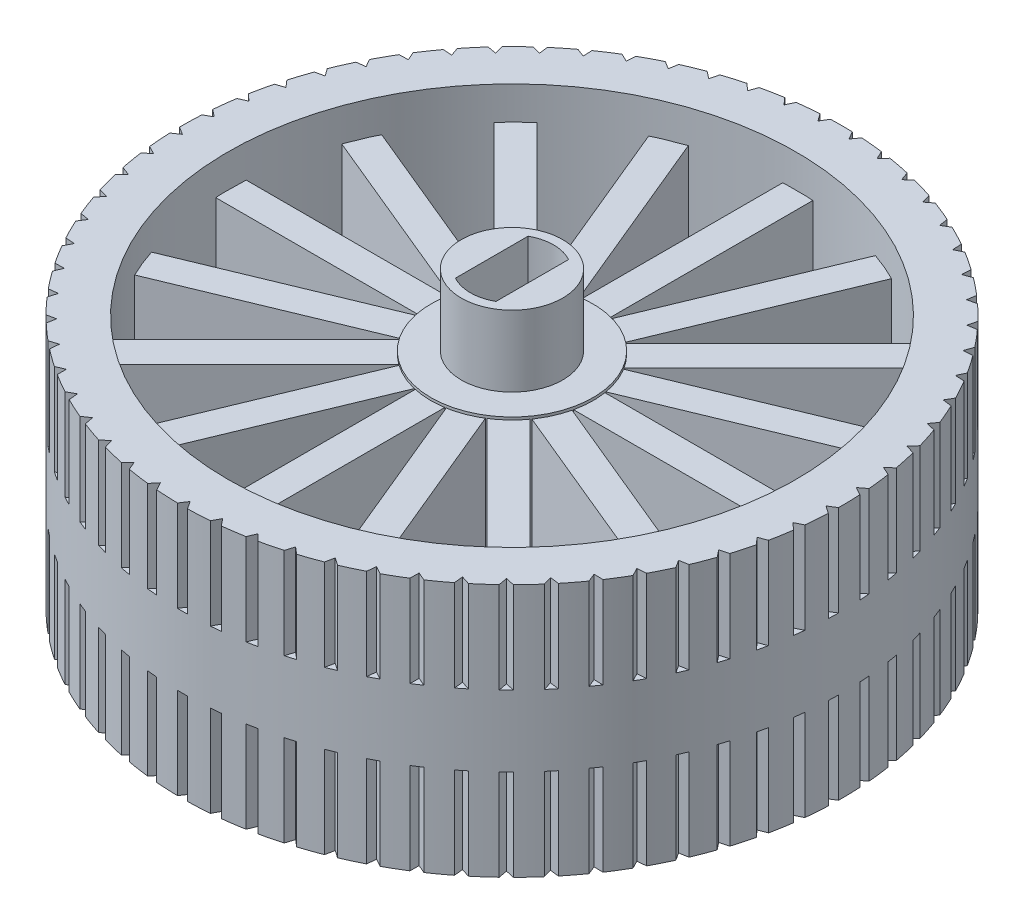
from build123d import *

# Parameters (mm, degrees)
SKETCH1_R               = 32.5
BOSS_EXTRUDE1_DEPTH     = 2
SKETCH2_R               = 4
BOSS_EXTRUDE2_DEPTH     = 2
CUT_EXTRUDE1_DEPTH      = 28
SKETCH5_R               = 8
BOSS_EXTRUDE3_DEPTH     = 2
CUT_EXTRUDE2_DEPTH      = 18
CUT_EXTRUDE2_DEPTH_BACK = 57.005434462
CUT_EXTRUDE2_START      = 10
SKETCH7_R               = 32.5
SKETCH7_R_2             = 28
BOSS_EXTRUDE4_DEPTH     = 23
BOSS_EXTRUDE5_START     = 25
SKETCH9_R               = 8
BOSS_EXTRUDE5_DEPTH     = 25
SKETCH12_W              = 3
SKETCH12_H              = 19.736770602
BOSS_EXTRUDE6_DEPTH     = 22
CIRPATTERN2_COUNT       = 16
CUT_EXTRUDE3_START      = -22
SKETCH13_R              = 28
CUT_EXTRUDE3_DEPTH      = 22
CUT_EXTRUDE6_DEPTH      = 9
SKETCH16_R              = 8
SKETCH16_R_2            = 5
CUT_EXTRUDE7_DEPTH      = 7


with BuildPart() as part:
    # Sketch1 → Boss-Extrude1 (new body)
    with BuildSketch(Plane(origin=(0, 0, 0), x_dir=(1, 0, 0), z_dir=(0, 1, 0))):
        Circle(SKETCH1_R)
    extrude(amount=BOSS_EXTRUDE1_DEPTH)

    # Sketch2 → Boss-Extrude2 (add)
    with BuildSketch(Plane(origin=(0, 2, 0), x_dir=(1, 0, 0), z_dir=(0, 1, 0))):
        Circle(SKETCH2_R)
    extrude(amount=BOSS_EXTRUDE2_DEPTH)

    # Sketch4 → Cut-Extrude1 (cut)
    with BuildSketch(Plane(origin=(0, 4, 0), x_dir=(1, 0, 0), z_dir=(0, 1, 0))):
        with BuildLine():
            Line((1.995, -3.581895448), (1.995, 3.581895448))
            ThreePointArc((1.995, 3.581895448), (0, 4.1), (-1.995, 3.581895448))
            Line((-1.995, 3.581895448), (-1.995, -3.581895448))
            ThreePointArc((-1.995, -3.581895448), (0, -4.1), (1.995, -3.581895448))
        make_face()
    extrude(amount=-CUT_EXTRUDE1_DEPTH, mode=Mode.SUBTRACT)

    # Sketch5 → Boss-Extrude3 (add)
    with BuildSketch(Plane(origin=(0, 2, 0), x_dir=(1, 0, 0), z_dir=(0, 1, 0))):
        Circle(SKETCH5_R)
    extrude(amount=BOSS_EXTRUDE3_DEPTH)

    # Sketch6 → Cut-Extrude2 (cut, two sides: drawn at the far end of the back side and taken through both)
    with BuildSketch(Plane.XZ.offset(-2).offset(CUT_EXTRUDE2_START - CUT_EXTRUDE2_DEPTH_BACK)):
        with BuildLine():
            Line((-1.995, 3.581895448), (-1.995, -3.581895448))
            ThreePointArc((-1.995, -3.581895448), (0, -4.1), (1.995, -3.581895448))
            Line((1.995, -3.581895448), (1.995, 3.581895448))
            ThreePointArc((1.995, 3.581895448), (0, 4.1), (-1.995, 3.581895448))
        make_face()
    extrude(amount=CUT_EXTRUDE2_DEPTH + CUT_EXTRUDE2_DEPTH_BACK, mode=Mode.SUBTRACT)

    # Sketch7 → Boss-Extrude4 (add)
    with BuildSketch(Plane(origin=(0, 2, 0), x_dir=(1, 0, 0), z_dir=(0, 1, 0))):
        Circle(SKETCH7_R)
        Circle(SKETCH7_R_2, mode=Mode.SUBTRACT)
    extrude(amount=BOSS_EXTRUDE4_DEPTH)

    # Sketch9 → Boss-Extrude5 (add)
    with BuildSketch(Plane(origin=(0, 4, 0), x_dir=(1, 0, 0), z_dir=(0, 1, 0)).offset(BOSS_EXTRUDE5_START)):
        Circle(SKETCH9_R)
        with BuildLine():
            Line((-1.995, -3.581895448), (-1.995, 3.581895448))
            ThreePointArc((-1.995, 3.581895448), (0, 4.1), (1.995, 3.581895448))
            Line((1.995, 3.581895448), (1.995, -3.581895448))
            ThreePointArc((1.995, -3.581895448), (0, -4.1), (-1.995, -3.581895448))
        make_face(mode=Mode.SUBTRACT)
    extrude(amount=-BOSS_EXTRUDE5_DEPTH)

    # Sketch13 → Cut-Extrude3 (cut)
    with BuildSketch(Plane(origin=(0, 2, 0), x_dir=(1, 0, 0), z_dir=(0, 1, 0)).offset(CUT_EXTRUDE3_START)):
        Circle(SKETCH13_R)
    extrude(amount=CUT_EXTRUDE3_DEPTH, mode=Mode.SUBTRACT)


with BuildPart() as body_2:
    # Sketch12 → Boss-Extrude6 (new body)
    with BuildSketch(Plane(origin=(-6.995, 0, 0), x_dir=(0, 0, -1), z_dir=(1, 0, 0))):
        with Locations((0.23460174, 11.868385301)):
            Rectangle(SKETCH12_W, SKETCH12_H)
    extrude(amount=-BOSS_EXTRUDE6_DEPTH)


with BuildPart() as cirpattern2_1:
    # CirPattern2: pattern copy
    add(body_2.part.rotate(Axis((0, 4, 0), (0, -1, 0)), 1 * 360 / CIRPATTERN2_COUNT))


with BuildPart() as cirpattern2_2:
    # CirPattern2: pattern copy
    add(body_2.part.rotate(Axis((0, 4, 0), (0, -1, 0)), 2 * 360 / CIRPATTERN2_COUNT))


with BuildPart() as cirpattern2_3:
    # CirPattern2: pattern copy
    add(body_2.part.rotate(Axis((0, 4, 0), (0, -1, 0)), 3 * 360 / CIRPATTERN2_COUNT))


with BuildPart() as cirpattern2_4:
    # CirPattern2: pattern copy
    add(body_2.part.rotate(Axis((0, 4, 0), (0, -1, 0)), 4 * 360 / CIRPATTERN2_COUNT))


with BuildPart() as cirpattern2_5:
    # CirPattern2: pattern copy
    add(body_2.part.rotate(Axis((0, 4, 0), (0, -1, 0)), 5 * 360 / CIRPATTERN2_COUNT))


with BuildPart() as cirpattern2_6:
    # CirPattern2: pattern copy
    add(body_2.part.rotate(Axis((0, 4, 0), (0, -1, 0)), 6 * 360 / CIRPATTERN2_COUNT))


with BuildPart() as cirpattern2_7:
    # CirPattern2: pattern copy
    add(body_2.part.rotate(Axis((0, 4, 0), (0, -1, 0)), 7 * 360 / CIRPATTERN2_COUNT))


with BuildPart() as cirpattern2_8:
    # CirPattern2: pattern copy
    add(body_2.part.rotate(Axis((0, 4, 0), (0, -1, 0)), 8 * 360 / CIRPATTERN2_COUNT))


with BuildPart() as cirpattern2_9:
    # CirPattern2: pattern copy
    add(body_2.part.rotate(Axis((0, 4, 0), (0, -1, 0)), 9 * 360 / CIRPATTERN2_COUNT))


with BuildPart() as cirpattern2_10:
    # CirPattern2: pattern copy
    add(body_2.part.rotate(Axis((0, 4, 0), (0, -1, 0)), 10 * 360 / CIRPATTERN2_COUNT))


with BuildPart() as cirpattern2_11:
    # CirPattern2: pattern copy
    add(body_2.part.rotate(Axis((0, 4, 0), (0, -1, 0)), 11 * 360 / CIRPATTERN2_COUNT))


with BuildPart() as cirpattern2_12:
    # CirPattern2: pattern copy
    add(body_2.part.rotate(Axis((0, 4, 0), (0, -1, 0)), 12 * 360 / CIRPATTERN2_COUNT))


with BuildPart() as cirpattern2_13:
    # CirPattern2: pattern copy
    add(body_2.part.rotate(Axis((0, 4, 0), (0, -1, 0)), 13 * 360 / CIRPATTERN2_COUNT))


with BuildPart() as cirpattern2_14:
    # CirPattern2: pattern copy
    add(body_2.part.rotate(Axis((0, 4, 0), (0, -1, 0)), 14 * 360 / CIRPATTERN2_COUNT))


with BuildPart() as cirpattern2_15:
    # CirPattern2: pattern copy
    add(body_2.part.rotate(Axis((0, 4, 0), (0, -1, 0)), 15 * 360 / CIRPATTERN2_COUNT))


with BuildPart() as cut_extrude3_piece_1:
    # of the separate pieces the step leaves, piece 1, a body of its own (cut_extrude3_pieces)
    add(part.part.solids().sort_by_distance((32.5, 0, 0))[0])

    # Sketch14 → Cut-Extrude6 (cut)
    with BuildSketch(Plane.XZ):
        Polygon((0, 31.75), (-0.527732221, 32.541598332), (0.518724425, 32.537676028), align=None)
        Polygon((3.656641521, 32.335714142), (2.615448673, 32.44061577), (3.064316989, 31.601779402), align=None)
        Polygon((6.76041754, 31.831842406), (5.734209828, 32.036743919), (6.100023276, 31.158501505), align=None)
        Polygon((9.801073362, 31.030765335), (8.799432211, 31.333753622), (9.078775289, 30.424305074), align=None)
        Polygon((12.750219203, 29.939962368), (11.782496667, 30.33820851), (11.972761224, 29.406045104), align=None)
        Polygon((15.580319683, 28.569618039), (14.655551125, 29.059403719), (14.754960712, 28.113228814), align=None)
        Polygon((18.264950915, 26.932526884), (17.391770651, 27.509279105), (17.399397109, 26.557926882), align=None)
        Polygon((20.779047222, 25.043973983), (19.965607901, 25.702307765), (19.881380022, 24.754660742), align=None)
        Polygon((23.099135164, 22.921592244), (22.353031649, 23.655360901), (22.177735847, 22.720267004), align=None)
        Polygon((25.203552704, 20.585197774), (24.531751163, 21.387550307), (24.267024127, 20.473740254), align=None)
        Polygon((27.072651464, 18.056604859), (26.481424327, 18.920049918), (26.129737742, 18.036055709), align=None)
        Polygon((28.688980171, 15.359422289), (28.183847566, 16.275898121), (27.748485036, 15.42997337), align=None)
        Polygon((30.0374476, 12.518832932), (29.623125815, 13.479782648), (29.108152201, 12.679825528), align=None)
        Polygon((31.105463474, 9.561358605), (30.785820919, 10.557810076), (30.196044392, 9.811289571), align=None)
        Polygon((31.883056017, 6.514612449), (31.661077108, 7.537262077), (31.002004253, 6.851148247), align=None)
        Polygon((32.362965055, 3.407041111), (32.240722351, 4.446340692), (31.518506753, 3.827039598), align=None)
        Polygon((32.540709809, 0.267659149), (32.519344656, 1.313905022), (31.740729447, 0.767198911), align=None)
        Polygon((32.414630723, -2.874221875), (32.494342602, -1.830798224), (31.666597503, -2.299804905), align=None)
        Polygon((31.985904964, -5.989267063), (32.165949626, -4.958407802), (31.29680307, -5.345336063), align=None)
        Polygon((31.258535428, -9.048392079), (31.537231845, -8.039722061), (30.634798819, -8.340959258), align=None)
        Polygon((30.239313369, -12.023034696), (30.614059428, -11.045971602), (29.686765705, -11.258705164), align=None)
        Polygon((28.937754988, -14.885421477), (29.405051786, -13.949087882), (28.461555259, -14.071331573), align=None)
        Polygon((27.366012586, -17.608827088), (27.921497098, -16.721965287), (26.97060694, -16.75257775), align=None)
        Polygon((25.538761098, -20.167823826), (26.177246915, -19.338714208), (25.227841331, -19.277409623), align=None)
        Polygon((23.473061079, -22.538519026), (24.188586831, -21.774902764), (23.249530164, -21.622253516), align=None)
        Polygon((21.188199413, -24.698778147), (21.974084429, -24.007784921), (21.054144399, -23.765216254), align=None)
        Polygon((18.705509237, -26.628431431), (19.554415921, -26.016512858), (18.66218176, -25.686289571), align=None)
        Polygon((16.048170762, -28.309462225), (16.9521731, -27.782331624), (16.095975359, -27.367536923), align=None)
        Polygon((13.240994841, -29.726175199), (14.191652406, -29.288754246), (13.379485172, -28.793260957), align=None)
        Polygon((10.310191318, -30.865342883), (11.298628078, -30.52171566), (10.538074337, -29.950150071), align=None)
        Polygon((7.283124317, -31.716329178), (8.300111504, -31.469704039), (7.598272341, -30.827402703), align=None)
        Polygon((4.188056746, -32.271188652), (5.224099024, -32.123868271), (4.587527324, -31.416828183), align=None)
        Polygon((1.053886418, -32.524740733), (2.09931054, -32.478100599), (1.5339498, -31.712923202), align=None)
        Polygon((-2.090123764, -32.474618073), (-1.045078641, -32.529093653), (-1.5339498, -31.712923202), align=None)
        Polygon((-5.214619023, -32.121288653), (-4.179710204, -32.276371325), (-4.587527324, -31.416828183), align=None)
        Polygon((-8.290426789, -31.468051417), (-7.27531694, -31.722293213), (-7.598272341, -30.827402703), align=None)
        Polygon((-11.288829075, -30.521005462), (-10.302996001, -30.872032597), (-10.538074337, -29.950150071), align=None)
        Polygon((-14.181830604, -29.288993104), (-13.234478765, -29.733528131), (-13.379485172, -28.793260957), align=None)
        Polygon((-16.942420203, -27.783517308), (-16.042394766, -28.317409723), (-16.095975359, -27.367536923), align=None)
        Polygon((-19.544822989, -26.018634297), (-18.70052725, -26.636899291), (-18.66218176, -25.686289571), align=None)
        Polygon((-21.964741028, -24.010822307), (-21.184057949, -24.707687307), (-21.054144399, -23.765216254), align=None)
        Polygon((-24.179580199, -21.77882774), (-23.469798808, -22.547786304), (-23.249530164, -21.622253516), align=None)
        Polygon((-26.168661144, -19.343490125), (-25.536408478, -20.177362695), (-25.227841331, -19.277409623), align=None)
        Polygon((-27.913412351, -16.727547555), (-27.364591582, -17.618548488), (-26.97060694, -16.75257775), align=None)
        Polygon((-29.397543548, -13.955424381), (-28.937278868, -14.89523464), (-28.461555259, -14.071331573), align=None)
        Polygon((-30.607197801, -11.053003169), (-30.239786578, -12.032847999), (-29.686765705, -11.258705164), align=None)
        Polygon((-31.531080896, -8.047383045), (-31.259953549, -9.058113899), (-30.634798819, -8.340959258), align=None)
        Polygon((-32.160566783, -4.966626673), (-31.988254755, -5.99880663), (-31.29680307, -5.345336063), align=None)
        Polygon((-32.489778123, -1.839498247), (-32.417890246, -2.88349012), (-31.666597503, -2.299804905), align=None)
        Polygon((-32.51564116, 1.304805079), (-32.54484863, 0.258748761), (-31.740729447, 0.767198911), align=None)
        Polygon((-32.237914415, 4.436925792), (-32.367944531, 3.398571774), (-31.518506753, 3.827039598), align=None)
        Polygon((-31.65919095, 7.527620124), (-31.888829655, 6.506663238), (-31.002004253, 6.851148247), align=None)
        Polygon((-30.784874148, 10.548031095), (-31.111977369, 9.554003741), (-30.196044392, 9.811289571), align=None)
        Polygon((-29.623127272, 13.469957942), (-30.044640932, 12.512141085), (-29.108152201, 12.679825528), align=None)
        Polygon((-28.184797237, 16.266119421), (-28.696785779, 15.353455939), (-27.748485036, 15.42997337), align=None)
        Polygon((-26.483313345, 18.910408525), (-27.080996468, 18.051419711), (-26.129737742, 18.036055709), align=None)
        Polygon((-24.534561892, 21.37813624), (-25.21235919, 20.580842241), (-24.267024127, 20.473740254), align=None)
        Polygon((-22.356737844, 23.646262057), (-23.108320907, 22.918106993), (-22.177735847, 22.720267004), align=None)
        Polygon((-19.970174959, 25.693609096), (-20.788526458, 25.041391554), (-19.881380022, 24.754660742), align=None)
        Polygon((-17.397155932, 27.50106183), (-18.274635139, 26.93087139), (-17.399397109, 26.557926882), align=None)
        Polygon((-14.661704346, 29.05174456), (-15.590118475, 28.568904935), (-14.754960712, 28.113228814), align=None)
        Polygon((-11.789360378, 30.331178978), (-12.760041076, 29.940198313), (-11.972761224, 29.406045104), align=None)
        Polygon((-8.806942328, 31.32741935), (-9.810826611, 31.031948126), (-9.078775289, 30.424305074), align=None)
        Polygon((-5.742296231, 32.031164049), (-6.770011101, 31.833961), (-6.100023276, 31.158501505), align=None)
        Polygon((-2.62403586, 32.435842399), (-3.665985822, 32.338748758), (-3.064316989, 31.601779402), align=None)
    cut_extrude6 = extrude(amount=-CUT_EXTRUDE6_DEPTH, mode=Mode.SUBTRACT)

    # Mirror1: Cut-Extrude6 across plane
    add(cut_extrude6.mirror(Plane.ZX.offset(12.5)), mode=Mode.SUBTRACT)


with BuildPart() as cut_extrude3_piece_2:
    # of the separate pieces the step leaves, piece 2, a body of its own (cut_extrude3_pieces)
    add(part.part.solids().sort_by_distance((1.995, 2, 3.581895448))[0])

    # Sketch16 → Cut-Extrude7 (cut)
    with BuildSketch(Plane(origin=(0, 29, 0), x_dir=(1, 0, 0), z_dir=(0, 1, 0))):
        Circle(SKETCH16_R)
        Circle(SKETCH16_R_2, mode=Mode.SUBTRACT)
    extrude(amount=-CUT_EXTRUDE7_DEPTH, mode=Mode.SUBTRACT)


solid = Compound([body_2.part, cirpattern2_1.part, cirpattern2_2.part, cirpattern2_3.part, cirpattern2_4.part, cirpattern2_5.part, cirpattern2_6.part, cirpattern2_7.part, cirpattern2_8.part, cirpattern2_9.part, cirpattern2_10.part, cirpattern2_11.part, cirpattern2_12.part, cirpattern2_13.part, cirpattern2_14.part, cirpattern2_15.part, cut_extrude3_piece_1.part, cut_extrude3_piece_2.part])
